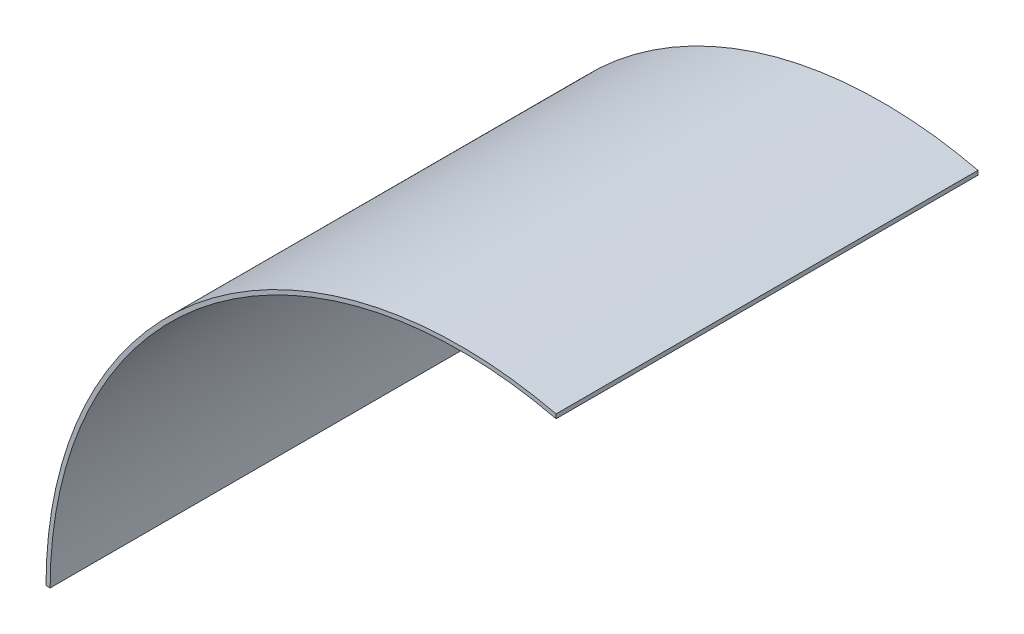
from build123d import *

# Parameters (mm, degrees)
INNER_RING_LEFT_SIDE_DEPTH = 155


with BuildPart() as part:
    # Sketch1 → Inner Ring - Left Side (new body)
    with BuildSketch(Plane.XY):
        with BuildLine():
            Line((35, 148.326531679), (35, 146.76546018))
            ThreePointArc((35, 146.76546018), (-93.499364976, 118.418617839), (-150.88108, 0))
            Line((-150.88108, 0), (-152.4, 0))
            ThreePointArc((-152.4, 0), (-94.582662259, 119.498451873), (35, 148.326531679))
        make_face()
    extrude(amount=INNER_RING_LEFT_SIDE_DEPTH)


solid = part.part
